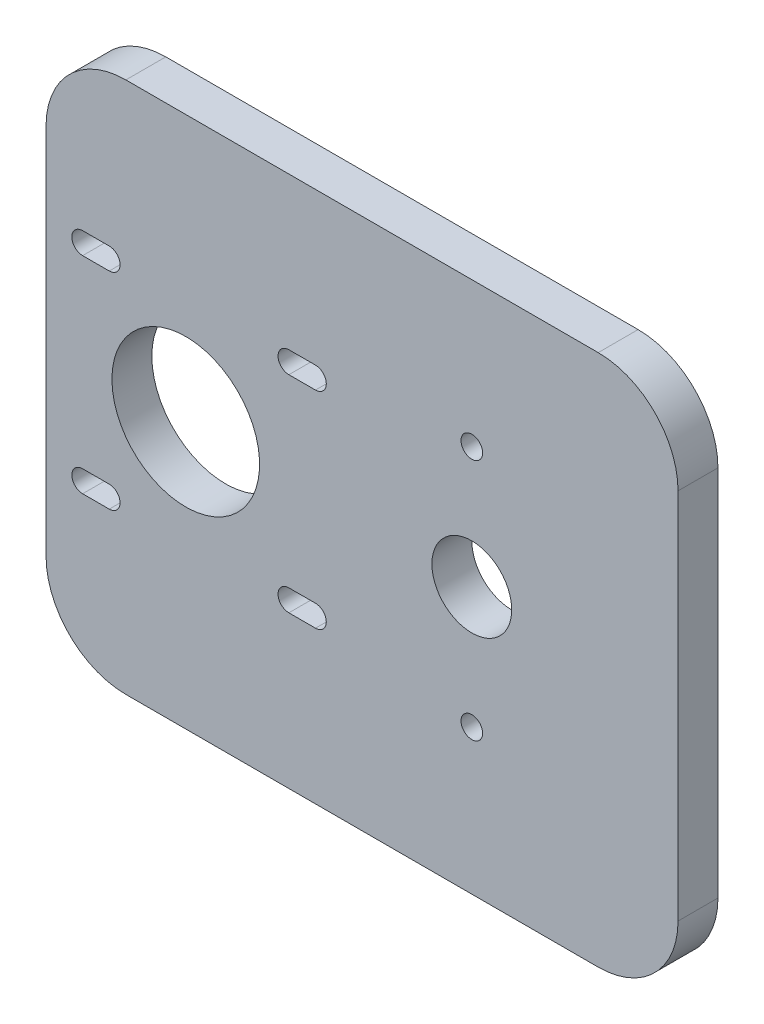
from build123d import *

# Parameters (mm, degrees)
CROQUIS1_W              = 95
CROQUIS1_H              = 80
SALIENTE_EXTRUIR1_DEPTH = 6
CROQUIS2_R              = 11.1
CROQUIS2_R_2            = 6
CROQUIS2_R_3            = 1.625
CORTAR_EXTRUIR1_DEPTH   = 125.342269563
REDONDEO1_R             = 12


with BuildPart() as part:
    # Croquis1 → Saliente-Extruir1 (new body)
    with BuildSketch(Plane.XY):
        with Locations((47.5, 40)):
            Rectangle(CROQUIS1_W, CROQUIS1_H)
    extrude(amount=SALIENTE_EXTRUIR1_DEPTH)

    # Croquis2 → Cortar-Extruir1 (cut, through all)
    with BuildSketch(Plane(origin=(0, 0, 0), x_dir=(-1, 0, 0), z_dir=(0, 0, -1))):
        with Locations((-21, 40)):
            Circle(CROQUIS2_R)
        with Locations((-64, 40)):
            Circle(CROQUIS2_R_2)
        with Locations((-64, 21.75)):
            Circle(CROQUIS2_R_3)
        with Locations((-64, 58.25)):
            Circle(CROQUIS2_R_3)
        with BuildLine():
            Line((-36.5, 53.875), (-40.5, 53.875))
            ThreePointArc((-40.5, 53.875), (-42.125, 55.5), (-40.5, 57.125))
            Line((-40.5, 57.125), (-36.5, 57.125))
            ThreePointArc((-36.5, 57.125), (-34.875, 55.5), (-36.5, 53.875))
        make_face()
        with BuildLine():
            Line((-36.5, 22.875), (-40.5, 22.875))
            ThreePointArc((-40.5, 22.875), (-42.125, 24.5), (-40.5, 26.125))
            Line((-40.5, 26.125), (-36.5, 26.125))
            ThreePointArc((-36.5, 26.125), (-34.875, 24.5), (-36.5, 22.875))
        make_face()
        with BuildLine():
            Line((-5.5, 22.875), (-9.5, 22.875))
            ThreePointArc((-9.5, 22.875), (-11.125, 24.5), (-9.5, 26.125))
            Line((-9.5, 26.125), (-5.5, 26.125))
            ThreePointArc((-5.5, 26.125), (-3.875, 24.5), (-5.5, 22.875))
        make_face()
        with BuildLine():
            Line((-5.5, 53.875), (-9.5, 53.875))
            ThreePointArc((-9.5, 53.875), (-11.125, 55.5), (-9.5, 57.125))
            Line((-9.5, 57.125), (-5.5, 57.125))
            ThreePointArc((-5.5, 57.125), (-3.875, 55.5), (-5.5, 53.875))
        make_face()
    extrude(amount=-CORTAR_EXTRUIR1_DEPTH, mode=Mode.SUBTRACT)

    # Redondeo1
    redondeo1_edges = [part.edges().sort_by_distance(p)[0] for p in [
        (95, 0, 3),
        (95, 80, 3),
        (0, 0, 3),
        (0, 80, 3),
    ]]
    fillet(redondeo1_edges, radius=REDONDEO1_R)


solid = part.part
